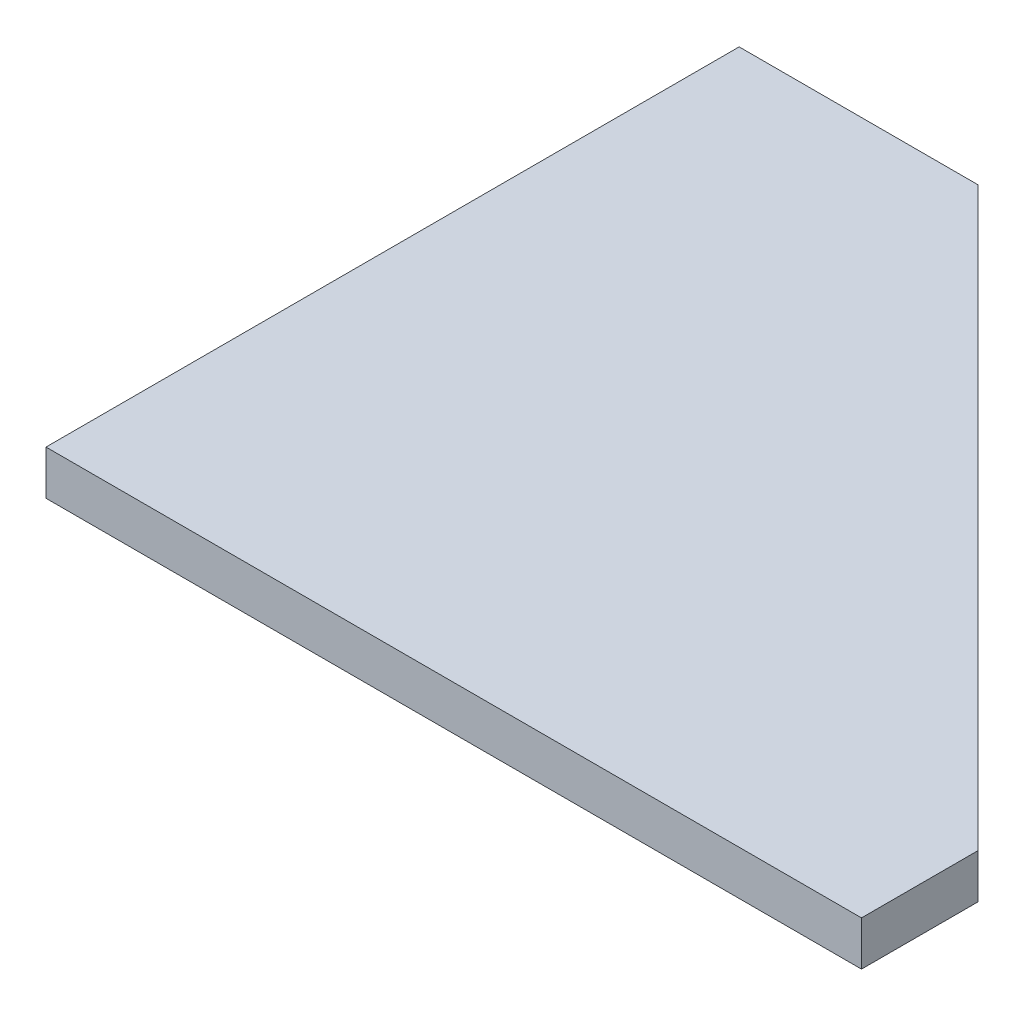
from build123d import *

# Parameters (mm, degrees)
BOSS_EXTRUDE1_DEPTH = 38.1
SKETCH2_W           = 19
SKETCH2_H           = 50
CUT_EXTRUDE1_DEPTH  = 2


with BuildPart() as part:
    # Sketch1 → Boss-Extrude1 (new body)
    with BuildSketch(Plane(origin=(0, 0, 0), x_dir=(1, 0, 0), z_dir=(0, 1, 0))):
        Polygon((-144.97, 297.485), (350, -197.485), (350, -297.485), (-350, -297.485), (-350, 297.485), align=None)
    extrude(amount=BOSS_EXTRUDE1_DEPTH)

    # Sketch2 → Cut-Extrude1 (cut)
    with BuildSketch(Plane.XZ):
        with Locations((-340.5, -132.485)):
            Rectangle(SKETCH2_W, SKETCH2_H)
        with Locations((-340.5, 132.485)):
            Rectangle(SKETCH2_W, SKETCH2_H)
    extrude(amount=-CUT_EXTRUDE1_DEPTH, mode=Mode.SUBTRACT)


solid = part.part
